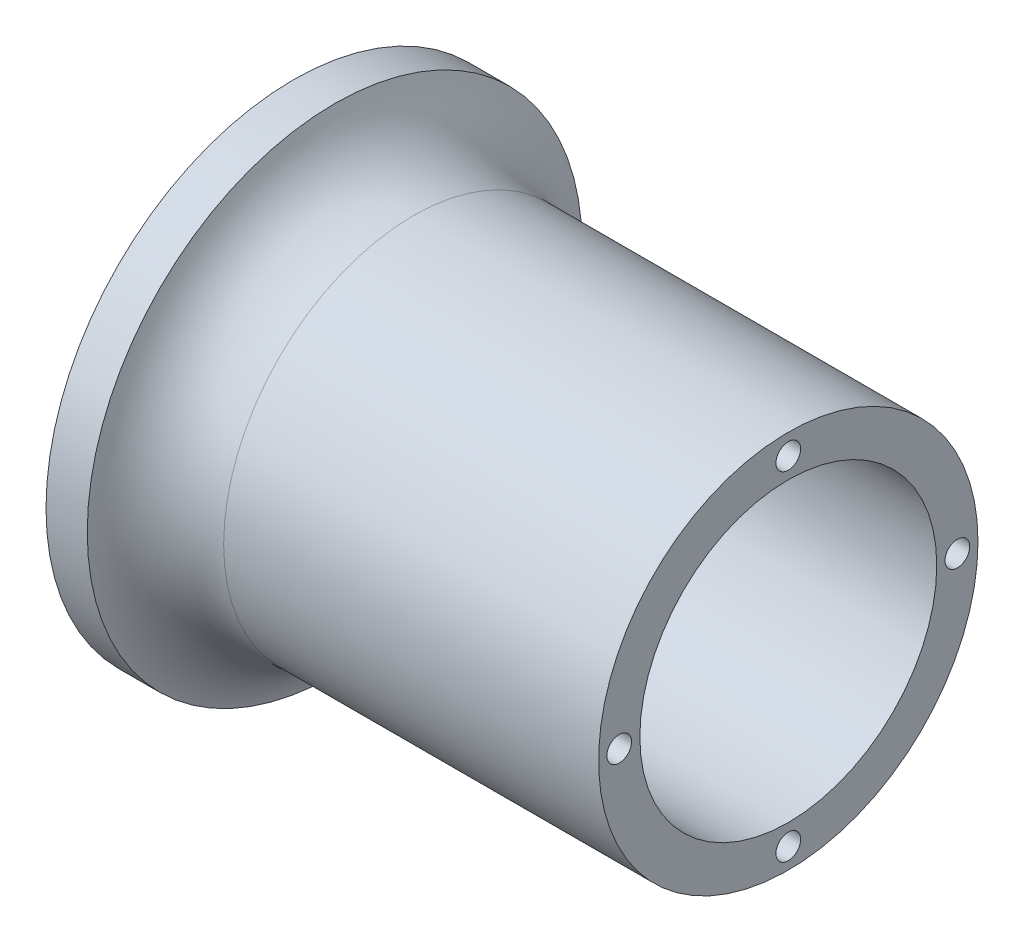
from build123d import *

# Parameters (mm, degrees)
SKETCH1_R                 = 23
SKETCH1_R_2               = 18
BOSS_EXTRUDE1_DEPTH       = 11
BOSS_EXTRUDE2_START       = 3
SKETCH1_13_R              = 23
SKETCH1_13_R_2            = 18
SKETCH1_13_R_3            = 3
SKETCH1_13_R_4            = 5.25
BOSS_EXTRUDE2_DEPTH       = 3
BOSS_EXTRUDE4_START       = 3
BOSS_EXTRUDE4_OUTLINE_R   = 23
BOSS_EXTRUDE4_OUTLINE_R_2 = 3
BOSS_EXTRUDE4_OUTLINE_R_3 = 5.25
BOSS_EXTRUDE4_DEPTH       = 3
BOSS_EXTRUDE5_START       = 60
SKETCH1_17_R              = 23
SKETCH1_17_R_2            = 18
BOSS_EXTRUDE5_DEPTH       = 60
SKETCH2_R                 = 1.5
CUT_EXTRUDE1_DEPTH        = 5
BOSS_EXTRUDE6_START       = 3
SKETCH1_20_R              = 3
SKETCH1_20_R_2            = 1.5
BOSS_EXTRUDE6_DEPTH       = 3
SKETCH1_21_R              = 23
SKETCH1_21_R_2            = 18
CUT_EXTRUDE4_DEPTH        = 23
SKETCH2_2_R               = 1.5
CUT_EXTRUDE5_DEPTH        = 9
BOSS_EXTRUDE7_START       = -5
SKETCH3_R                 = 30
SKETCH3_R_2               = 23
BOSS_EXTRUDE7_DEPTH       = 5
FILLET1_R                 = 10


# Read off the part's stored shape, not the designer's step: Boss-Extrude4
with BuildPart() as part:
    # Sketch1 → Boss-Extrude1 (new body)
    with BuildSketch(Plane(origin=(0, 0, 0), x_dir=(0, 0, -1), z_dir=(1, 0, 0))):
        Circle(SKETCH1_R)
        Circle(SKETCH1_R_2, mode=Mode.SUBTRACT)
    extrude(amount=-BOSS_EXTRUDE1_DEPTH)

    # Sketch1<13> → Boss-Extrude2 (add)
    # profile 1 of 2: a face of its own
    with BuildSketch(Plane(origin=(0, 0, 0), x_dir=(0, 0, -1), z_dir=(1, 0, 0)).offset(BOSS_EXTRUDE2_START)):
        Circle(SKETCH1_13_R)
        Circle(SKETCH1_13_R_2, mode=Mode.SUBTRACT)
    # profile 2 of 2: a face of its own
    with BuildSketch(Plane(origin=(0, 0, 0), x_dir=(0, 0, -1), z_dir=(1, 0, 0)).offset(BOSS_EXTRUDE2_START)):
        Circle(SKETCH1_13_R_2)
        with Locations((-8.5, 0)):
            Circle(SKETCH1_13_R_3, mode=Mode.SUBTRACT)
        with Locations((8.5, 0)):
            Circle(SKETCH1_13_R_3, mode=Mode.SUBTRACT)
        Circle(SKETCH1_13_R_4, mode=Mode.SUBTRACT)
        with Locations((0, -8.5)):
            Circle(SKETCH1_13_R_3, mode=Mode.SUBTRACT)
        with Locations((0, 8.5)):
            Circle(SKETCH1_13_R_3, mode=Mode.SUBTRACT)
    extrude(amount=-BOSS_EXTRUDE2_DEPTH)

    # Boss-Extrude4 outline → Boss-Extrude4 (add)
    with BuildSketch(Plane(origin=(0, 0, 0), x_dir=(0, 0, -1), z_dir=(1, 0, 0)).offset(BOSS_EXTRUDE4_START)):
        Circle(BOSS_EXTRUDE4_OUTLINE_R)
        with Locations((0, -8.5)):
            Circle(BOSS_EXTRUDE4_OUTLINE_R_2, mode=Mode.SUBTRACT)
        with Locations((-8.5, 0)):
            Circle(BOSS_EXTRUDE4_OUTLINE_R_2, mode=Mode.SUBTRACT)
        Circle(BOSS_EXTRUDE4_OUTLINE_R_3, mode=Mode.SUBTRACT)
        with Locations((8.5, 0)):
            Circle(BOSS_EXTRUDE4_OUTLINE_R_2, mode=Mode.SUBTRACT)
        with Locations((0, 8.5)):
            Circle(BOSS_EXTRUDE4_OUTLINE_R_2, mode=Mode.SUBTRACT)
    extrude(amount=BOSS_EXTRUDE4_DEPTH)

    # Sketch1<17> → Boss-Extrude5 (add)
    with BuildSketch(Plane(origin=(0, 0, 0), x_dir=(0, 0, -1), z_dir=(1, 0, 0)).offset(BOSS_EXTRUDE5_START)):
        Circle(SKETCH1_17_R)
        Circle(SKETCH1_17_R_2, mode=Mode.SUBTRACT)
    extrude(amount=-BOSS_EXTRUDE5_DEPTH)

    # Sketch2 → Cut-Extrude1 (cut)
    with BuildSketch(Plane(origin=(60, 0, 0), x_dir=(0, 0, -1), z_dir=(1, 0, 0))):
        with Locations((0, 20.5)):
            Circle(SKETCH2_R)
        with Locations((20.5, 0)):
            Circle(SKETCH2_R)
        with Locations((0, -20.5)):
            Circle(SKETCH2_R)
        with Locations((-20.5, 0)):
            Circle(SKETCH2_R)
    extrude(amount=-CUT_EXTRUDE1_DEPTH, mode=Mode.SUBTRACT)

    # Sketch1<20> → Boss-Extrude6 (add)
    # profile 1 of 4: a face of its own
    with BuildSketch(Plane(origin=(0, 0, 0), x_dir=(0, 0, -1), z_dir=(1, 0, 0)).offset(BOSS_EXTRUDE6_START)):
        with Locations((0, 8.5)):
            Circle(SKETCH1_20_R)
        with Locations((0, 8.5)):
            Circle(SKETCH1_20_R_2, mode=Mode.SUBTRACT)
    # profile 2 of 4: a face of its own
    with BuildSketch(Plane(origin=(0, 0, 0), x_dir=(0, 0, -1), z_dir=(1, 0, 0)).offset(BOSS_EXTRUDE6_START)):
        with Locations((-8.5, 0)):
            Circle(SKETCH1_20_R)
        with Locations((-8.5, 0)):
            Circle(SKETCH1_20_R_2, mode=Mode.SUBTRACT)
    # profile 3 of 4: a face of its own
    with BuildSketch(Plane(origin=(0, 0, 0), x_dir=(0, 0, -1), z_dir=(1, 0, 0)).offset(BOSS_EXTRUDE6_START)):
        with Locations((0, -8.5)):
            Circle(SKETCH1_20_R)
        with Locations((0, -8.5)):
            Circle(SKETCH1_20_R_2, mode=Mode.SUBTRACT)
    # profile 4 of 4: a face of its own
    with BuildSketch(Plane(origin=(0, 0, 0), x_dir=(0, 0, -1), z_dir=(1, 0, 0)).offset(BOSS_EXTRUDE6_START)):
        with Locations((8.5, 0)):
            Circle(SKETCH1_20_R)
        with Locations((8.5, 0)):
            Circle(SKETCH1_20_R_2, mode=Mode.SUBTRACT)
    extrude(amount=BOSS_EXTRUDE6_DEPTH)

    # Sketch1<21> → Cut-Extrude4 (cut)
    with BuildSketch(Plane(origin=(0, 0, 0), x_dir=(0, 0, -1), z_dir=(1, 0, 0))):
        Circle(SKETCH1_21_R)
        Circle(SKETCH1_21_R_2, mode=Mode.SUBTRACT)
    extrude(amount=-CUT_EXTRUDE4_DEPTH, mode=Mode.SUBTRACT)

    # Sketch2<2> → Cut-Extrude5 (cut)
    with BuildSketch(Plane(origin=(60, 0, 0), x_dir=(0, 0, -1), z_dir=(1, 0, 0))):
        with Locations((0, 20.5)):
            Circle(SKETCH2_2_R)
        with Locations((20.5, 0)):
            Circle(SKETCH2_2_R)
        with Locations((0, -20.5)):
            Circle(SKETCH2_2_R)
        with Locations((-20.5, 0)):
            Circle(SKETCH2_2_R)
    extrude(amount=-CUT_EXTRUDE5_DEPTH, mode=Mode.SUBTRACT)

    # Sketch3 → Boss-Extrude7 (add)
    with BuildSketch(Plane.ZY.offset(BOSS_EXTRUDE7_START)):
        Circle(SKETCH3_R)
        with Locations(Location((0, 0, 0), (0, 0, 180))):
            Circle(SKETCH3_R_2, mode=Mode.SUBTRACT)
    extrude(amount=BOSS_EXTRUDE7_DEPTH)

    # Fillet1
    # the kernel refuses this fillet: 10 mm, written as the material it adds along each edge
    with BuildSketch(Plane(origin=(5, 0, 0), x_dir=(0, 0, -1), z_dir=(0, 1, 0))) as fillet1_piece_1:
        with BuildLine():
            CenterArc((33, -9.539392014), FILLET1_R, 107.457603124, 72.542396876)
            Line((30, 0), (29.94, 0.19078784))
            ThreePointArc((29.94, 0.19078784), (26.5, 0.2), (23, 0.2))
            Line((23, 0.2), (22.8, 0))
            Line((22.8, 0), (22.8, -9.539392014))
            Line((22.8, -9.539392014), (23, -9.539392014))
        make_face()
    revolve(axis=Axis((5, 0, 0), (-1, 0, 0)))


solid = part.part
